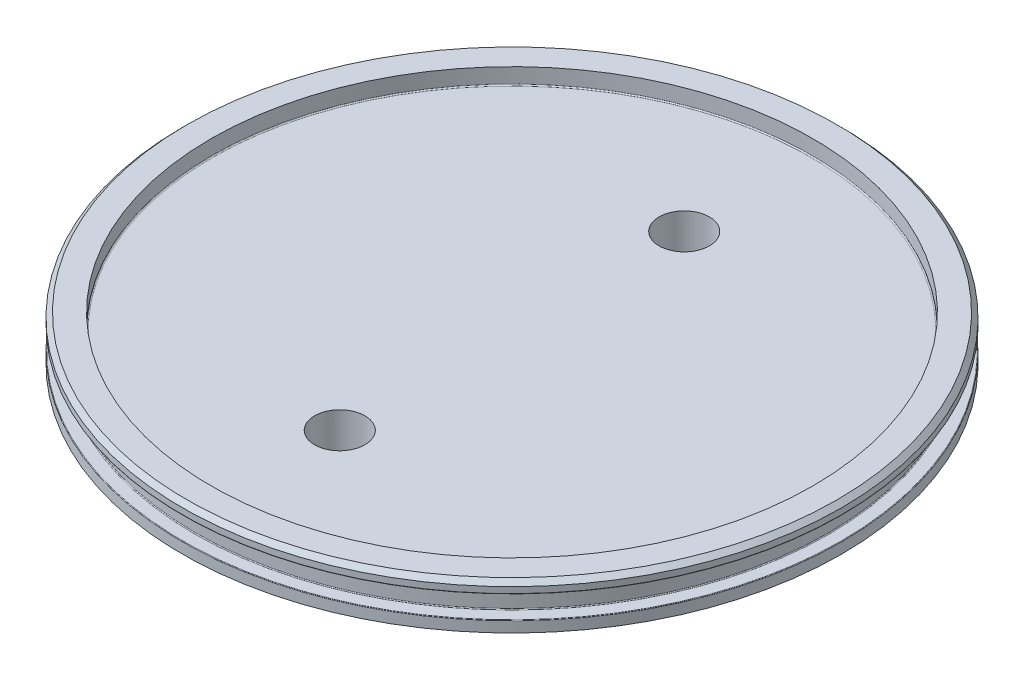
from build123d import *

# Parameters (mm, degrees)
SKETCH6_R                                = 66.04
BOSS_EXTRUDE1_DEPTH                      = 2.54
CNC_ID_FILLET_R                          = 0.1778
CNC_OD_FILLET_R                          = 0.127
CNC_CHAMFERS_SIZE                        = 1.016
CNC_BORE_FILLET_R                        = 0.254
PIPE_TAP_DRILL_FOR_1_4_TAP_RELIEF_VALV_D = 11.1252
PIPE_TAP_DRILL_FOR_1_4_TAP_VENT_VALVE_D  = 11.1252


with BuildPart() as part:
    # Sketch1 → Revolve1 (revolve)
    with BuildSketch(Plane.XY):
        Polygon((0, 0), (72.898, 0), (72.898, 2.4638), (69.977, 2.4638), (69.977, 7.4422), (72.898, 7.4422), (72.898, 9.906), (66.548, 9.906), (66.548, 6.35), (0, 6.35), align=None)
    revolve(axis=Axis((0, 48.192213231, 0), (0, -1, 0)))

    # Sketch6 → Boss-Extrude1 (add)
    with BuildSketch(Plane.XZ):
        Circle(SKETCH6_R)
    extrude(amount=BOSS_EXTRUDE1_DEPTH)

    # CNC ID Fillet
    cnc_id_fillet_edges = [part.edges().sort_by_distance(p)[0] for p in [
        (-69.977, 7.4422, 0),
        (-69.977, 2.4638, 0),
        (-66.04, 0, 0),
    ]]
    fillet(cnc_id_fillet_edges, radius=CNC_ID_FILLET_R)

    # CNC OD Fillet
    cnc_od_fillet_edges = [part.edges().sort_by_distance(p)[0] for p in [
        (-72.898, 7.4422, 0),
        (-72.898, 2.4638, 0),
        (-66.04, -2.54, 0),
    ]]
    fillet(cnc_od_fillet_edges, radius=CNC_OD_FILLET_R)

    # CNC Chamfers
    cnc_chamfers_edges = [part.edges().sort_by_distance(p)[0] for p in [
        (-72.898, 9.906, 0),
    ]]
    chamfer(cnc_chamfers_edges, length=CNC_CHAMFERS_SIZE)

    # CNC Bore Fillet
    cnc_bore_fillet_edges = [part.edges().sort_by_distance(p)[0] for p in [
        (-66.548, 6.35, 0),
    ]]
    fillet(cnc_bore_fillet_edges, radius=CNC_BORE_FILLET_R)

    # Pipe Tap Drill for 1/4 Tap - Relief Valve (through all)
    with Locations(Plane(origin=(0, -2.54, 0), x_dir=(-1, 0, 0), z_dir=(0, -1, 0))):
        with Locations((0, 38.1)):
            Hole(PIPE_TAP_DRILL_FOR_1_4_TAP_RELIEF_VALV_D / 2)

    # Pipe Tap Drill for 1/4 Tap - Vent Valve (through all)
    with Locations(Plane(origin=(0, -2.54, 0), x_dir=(-1, 0, 0), z_dir=(0, -1, 0))):
        with Locations((0, -38.1)):
            Hole(PIPE_TAP_DRILL_FOR_1_4_TAP_VENT_VALVE_D / 2)


solid = part.part
